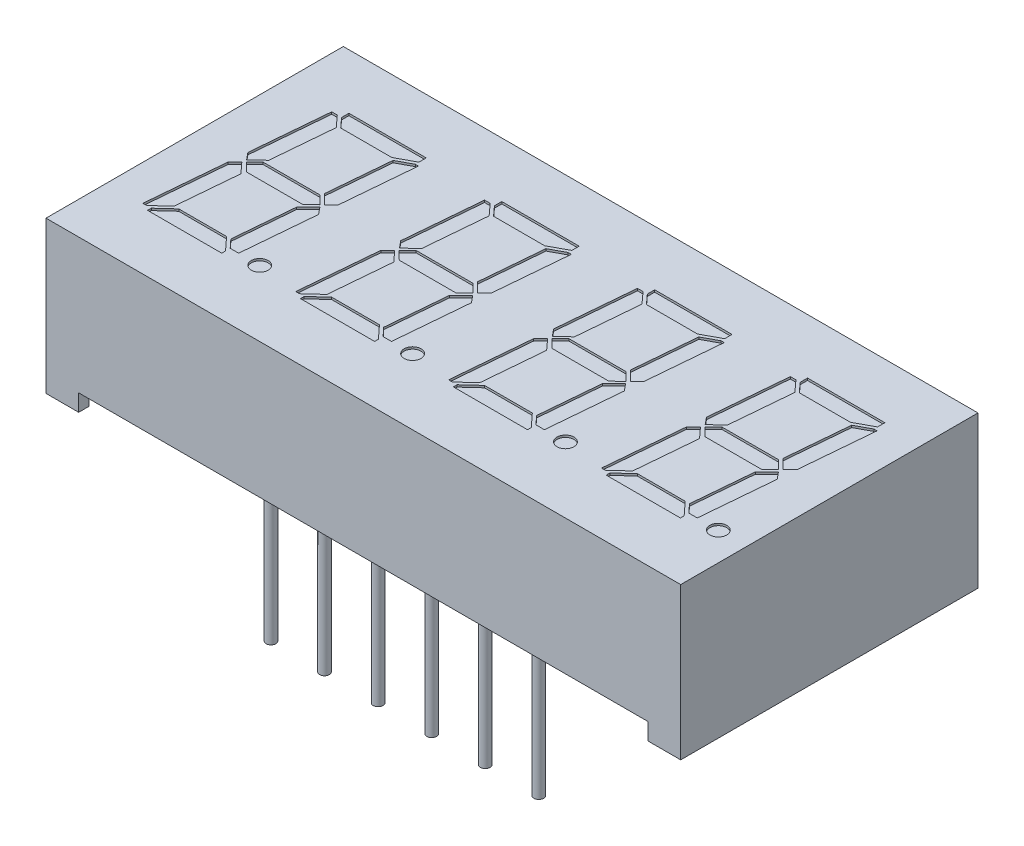
from build123d import *

# Parameters (mm, degrees)
SKETCH1_W                      = 30.1
SKETCH1_H                      = 14.1
BOSS_EXTRUDE1_DEPTH            = 7.2
SKETCH2_W                      = 27
SKETCH2_H                      = 0.8
CUT_EXTRUDE1_DEPTH             = 14.1
SKETCH3_W                      = 29.1
SKETCH3_H                      = 13.1
CUT_EXTRUDE2_DEPTH             = 0.5
CUT_EXTRUDE2_DIRECTION_2_REACH = 19.809
FILLET1_R                      = 1
FILLET2_R                      = 0.1
SKETCH4_R                      = 0.23
BOSS_EXTRUDE2_DEPTH            = 8.1
SKETCH5_R                      = 0.4
CUT_EXTRUDE3_DEPTH             = 0.1
LPATTERN1_COUNT                = 4
LPATTERN1_PITCH                = 7.25


with BuildPart() as part:
    # Sketch1 → Boss-Extrude1 (new body)
    with BuildSketch(Plane(origin=(0, 0, 0), x_dir=(1, 0, 0), z_dir=(0, 1, 0))):
        Rectangle(SKETCH1_W, SKETCH1_H)
    extrude(amount=-BOSS_EXTRUDE1_DEPTH)

    # Sketch2 → Cut-Extrude1 (cut)
    with BuildSketch(Plane.XY.offset(7.05)):
        with Locations((0, -6.8)):
            Rectangle(SKETCH2_W, SKETCH2_H)
    extrude(amount=-CUT_EXTRUDE1_DEPTH, mode=Mode.SUBTRACT)

    # Sketch3 → Cut-Extrude2 (cut)
    with BuildSketch(Plane.XZ.offset(6.4)):
        Rectangle(SKETCH3_W, SKETCH3_H)
    extrude(amount=-CUT_EXTRUDE2_DEPTH, mode=Mode.SUBTRACT)

    # Cut-Extrude2 direction 2: up to this face of the body (flat: up to its plane)
    cut_extrude2_direction_2_end = Plane(part.part.faces().sort_by_distance((-14.275, -7.2, 0))[0])
    # Sketch3 → Cut-Extrude2 direction 2 (cut, up to the picked face)
    with BuildSketch(Plane.XZ.offset(6.4), mode=Mode.PRIVATE) as cut_extrude2_direction_2_sk1:
        Rectangle(SKETCH3_W, SKETCH3_H)
    cut_extrude2_direction_2_tool1 = split(extrude(cut_extrude2_direction_2_sk1.sketch, amount=CUT_EXTRUDE2_DIRECTION_2_REACH, mode=Mode.PRIVATE), bisect_by=cut_extrude2_direction_2_end, keep=Keep.BOTH, mode=Mode.PRIVATE)
    add(cut_extrude2_direction_2_tool1.solids().sort_by(Axis((0, -6.4, 0), (0, -1, 0)))[0], mode=Mode.SUBTRACT)

    # Fillet1
    # the kernel refuses this fillet: 1 mm, written as the material it adds along each edge
    with BuildSketch(Plane(origin=(14.55, -5.9, 6.55), x_dir=(-1, 0, 0), z_dir=(0, 0, -1))) as fillet1_piece_1:
        with BuildLine():
            CenterArc((FILLET1_R, -FILLET1_R), FILLET1_R, 90, 90)
            Line((0, -FILLET1_R), (0, 0))
            Line((0, 0), (FILLET1_R, 0))
        make_face()
    extrude(amount=13.1)
    with BuildSketch(Plane(origin=(-14.55, -5.9, 6.55), x_dir=(0, -1, 0), z_dir=(1, 0, 0))) as fillet1_piece_2_section:
        with BuildLine():
            CenterArc((FILLET1_R, FILLET1_R), FILLET1_R, 180, 90)
            Line((0, FILLET1_R), (0, 0))
            Line((0, 0), (FILLET1_R, 0))
        make_face()
    fillet1_piece_2 = extrude(amount=29.1, mode=Mode.PRIVATE)
    fillet1_piece_2 = split(fillet1_piece_2, bisect_by=Plane(origin=(-13.5, -6.563250785, 6.525991618), z_dir=(-1, 0, 0)), keep=Keep.TOP, mode=Mode.PRIVATE)
    fillet1_piece_2 = split(fillet1_piece_2, bisect_by=Plane(origin=(-14.025, -6.4, 6.525991618), z_dir=(0, -1, 0)), keep=Keep.TOP, mode=Mode.PRIVATE)
    add(fillet1_piece_2)
    with BuildSketch(Plane(origin=(-14.55, -5.9, 6.55), x_dir=(0, -1, 0), z_dir=(1, 0, 0))) as fillet1_piece_3_section:
        with BuildLine():
            CenterArc((FILLET1_R, FILLET1_R), FILLET1_R, 180, 90)
            Line((0, FILLET1_R), (0, 0))
            Line((0, 0), (FILLET1_R, 0))
        make_face()
    fillet1_piece_3 = extrude(amount=29.1, mode=Mode.PRIVATE)
    fillet1_piece_3 = split(fillet1_piece_3, bisect_by=Plane(origin=(-13.5, -6.064391764, 6.29487994), z_dir=(-1, 0, 0)), keep=Keep.TOP, mode=Mode.PRIVATE)
    fillet1_piece_3 = split(fillet1_piece_3, bisect_by=Plane(origin=(-14.025, -6.4, 6.29487994), z_dir=(0, 1, 0)), keep=Keep.TOP, mode=Mode.PRIVATE)
    add(fillet1_piece_3)
    with BuildSketch(Plane(origin=(-14.55, -5.9, 6.55), x_dir=(0, -1, 0), z_dir=(1, 0, 0))) as fillet1_piece_4_section:
        with BuildLine():
            CenterArc((FILLET1_R, FILLET1_R), FILLET1_R, 180, 90)
            Line((0, FILLET1_R), (0, 0))
            Line((0, 0), (FILLET1_R, 0))
        make_face()
    fillet1_piece_4 = extrude(amount=29.1, mode=Mode.PRIVATE)
    fillet1_piece_4 = split(fillet1_piece_4, bisect_by=Plane(origin=(13.5, -6.064391764, 6.29487994), z_dir=(-1, 0, 0)), keep=Keep.TOP, mode=Mode.PRIVATE)
    fillet1_piece_4 = split(fillet1_piece_4, bisect_by=Plane(origin=(-13.5, -6.064391764, 6.29487994), z_dir=(1, 0, 0)), keep=Keep.TOP, mode=Mode.PRIVATE)
    fillet1_piece_4 = split(fillet1_piece_4, bisect_by=Plane(origin=(0, -6.4, 6.29487994), z_dir=(0, 1, 0)), keep=Keep.TOP, mode=Mode.PRIVATE)
    add(fillet1_piece_4)
    with BuildSketch(Plane(origin=(-14.55, -5.9, 6.55), x_dir=(0, -1, 0), z_dir=(1, 0, 0))) as fillet1_piece_5_section:
        with BuildLine():
            CenterArc((FILLET1_R, FILLET1_R), FILLET1_R, 180, 90)
            Line((0, FILLET1_R), (0, 0))
            Line((0, 0), (FILLET1_R, 0))
        make_face()
    fillet1_piece_5 = extrude(amount=29.1, mode=Mode.PRIVATE)
    fillet1_piece_5 = split(fillet1_piece_5, bisect_by=Plane(origin=(13.5, -6.563250785, 6.525991618), z_dir=(1, 0, 0)), keep=Keep.TOP, mode=Mode.PRIVATE)
    fillet1_piece_5 = split(fillet1_piece_5, bisect_by=Plane(origin=(14.025, -6.4, 6.525991618), z_dir=(0, -1, 0)), keep=Keep.TOP, mode=Mode.PRIVATE)
    add(fillet1_piece_5)
    with BuildSketch(Plane(origin=(-14.55, -5.9, 6.55), x_dir=(0, -1, 0), z_dir=(1, 0, 0))) as fillet1_piece_6_section:
        with BuildLine():
            CenterArc((FILLET1_R, FILLET1_R), FILLET1_R, 180, 90)
            Line((0, FILLET1_R), (0, 0))
            Line((0, 0), (FILLET1_R, 0))
        make_face()
    fillet1_piece_6 = extrude(amount=29.1, mode=Mode.PRIVATE)
    fillet1_piece_6 = split(fillet1_piece_6, bisect_by=Plane(origin=(13.5, -6.064391764, 6.29487994), z_dir=(1, 0, 0)), keep=Keep.TOP, mode=Mode.PRIVATE)
    fillet1_piece_6 = split(fillet1_piece_6, bisect_by=Plane(origin=(14.025, -6.4, 6.29487994), z_dir=(0, 1, 0)), keep=Keep.TOP, mode=Mode.PRIVATE)
    add(fillet1_piece_6)
    with BuildSketch(Plane(origin=(-14.55, -5.9, -6.55), x_dir=(0, -1, 0), z_dir=(0, 0, 1))) as fillet1_piece_7:
        with BuildLine():
            CenterArc((FILLET1_R, FILLET1_R), FILLET1_R, 180, 90)
            Line((0, FILLET1_R), (0, 0))
            Line((0, 0), (FILLET1_R, 0))
        make_face()
    extrude(amount=13.1)
    with BuildSketch(Plane(origin=(14.55, -5.9, -6.55), x_dir=(0, -1, 0), z_dir=(-1, 0, 0))) as fillet1_piece_8_section:
        with BuildLine():
            CenterArc((FILLET1_R, FILLET1_R), FILLET1_R, 180, 90)
            Line((0, FILLET1_R), (0, 0))
            Line((0, 0), (FILLET1_R, 0))
        make_face()
    fillet1_piece_8 = extrude(amount=29.1, mode=Mode.PRIVATE)
    fillet1_piece_8 = split(fillet1_piece_8, bisect_by=Plane(origin=(13.5, -6.563250785, -6.525991618), z_dir=(1, 0, 0)), keep=Keep.TOP, mode=Mode.PRIVATE)
    fillet1_piece_8 = split(fillet1_piece_8, bisect_by=Plane(origin=(14.025, -6.4, -6.525991618), z_dir=(0, -1, 0)), keep=Keep.TOP, mode=Mode.PRIVATE)
    add(fillet1_piece_8)
    with BuildSketch(Plane(origin=(14.55, -5.9, -6.55), x_dir=(0, -1, 0), z_dir=(-1, 0, 0))) as fillet1_piece_9_section:
        with BuildLine():
            CenterArc((FILLET1_R, FILLET1_R), FILLET1_R, 180, 90)
            Line((0, FILLET1_R), (0, 0))
            Line((0, 0), (FILLET1_R, 0))
        make_face()
    fillet1_piece_9 = extrude(amount=29.1, mode=Mode.PRIVATE)
    fillet1_piece_9 = split(fillet1_piece_9, bisect_by=Plane(origin=(13.5, -6.064391764, -6.29487994), z_dir=(1, 0, 0)), keep=Keep.TOP, mode=Mode.PRIVATE)
    fillet1_piece_9 = split(fillet1_piece_9, bisect_by=Plane(origin=(14.025, -6.4, -6.29487994), z_dir=(0, 1, 0)), keep=Keep.TOP, mode=Mode.PRIVATE)
    add(fillet1_piece_9)
    with BuildSketch(Plane(origin=(14.55, -5.9, -6.55), x_dir=(0, -1, 0), z_dir=(-1, 0, 0))) as fillet1_piece_10_section:
        with BuildLine():
            CenterArc((FILLET1_R, FILLET1_R), FILLET1_R, 180, 90)
            Line((0, FILLET1_R), (0, 0))
            Line((0, 0), (FILLET1_R, 0))
        make_face()
    fillet1_piece_10 = extrude(amount=29.1, mode=Mode.PRIVATE)
    fillet1_piece_10 = split(fillet1_piece_10, bisect_by=Plane(origin=(13.5, -6.064391764, -6.29487994), z_dir=(-1, 0, 0)), keep=Keep.TOP, mode=Mode.PRIVATE)
    fillet1_piece_10 = split(fillet1_piece_10, bisect_by=Plane(origin=(0, -6.4, -6.29487994), z_dir=(0, 1, 0)), keep=Keep.TOP, mode=Mode.PRIVATE)
    fillet1_piece_10 = split(fillet1_piece_10, bisect_by=Plane(origin=(-13.5, -6.064391764, -6.29487994), z_dir=(1, 0, 0)), keep=Keep.TOP, mode=Mode.PRIVATE)
    add(fillet1_piece_10)
    with BuildSketch(Plane(origin=(14.55, -5.9, -6.55), x_dir=(0, -1, 0), z_dir=(-1, 0, 0))) as fillet1_piece_11_section:
        with BuildLine():
            CenterArc((FILLET1_R, FILLET1_R), FILLET1_R, 180, 90)
            Line((0, FILLET1_R), (0, 0))
            Line((0, 0), (FILLET1_R, 0))
        make_face()
    fillet1_piece_11 = extrude(amount=29.1, mode=Mode.PRIVATE)
    fillet1_piece_11 = split(fillet1_piece_11, bisect_by=Plane(origin=(-14.025, -6.4, -6.525991618), z_dir=(0, -1, 0)), keep=Keep.TOP, mode=Mode.PRIVATE)
    fillet1_piece_11 = split(fillet1_piece_11, bisect_by=Plane(origin=(-13.5, -6.563250785, -6.525991618), z_dir=(-1, 0, 0)), keep=Keep.TOP, mode=Mode.PRIVATE)
    add(fillet1_piece_11)
    with BuildSketch(Plane(origin=(14.55, -5.9, -6.55), x_dir=(0, -1, 0), z_dir=(-1, 0, 0))) as fillet1_piece_12_section:
        with BuildLine():
            CenterArc((FILLET1_R, FILLET1_R), FILLET1_R, 180, 90)
            Line((0, FILLET1_R), (0, 0))
            Line((0, 0), (FILLET1_R, 0))
        make_face()
    fillet1_piece_12 = extrude(amount=29.1, mode=Mode.PRIVATE)
    fillet1_piece_12 = split(fillet1_piece_12, bisect_by=Plane(origin=(-14.025, -6.4, -6.29487994), z_dir=(0, 1, 0)), keep=Keep.TOP, mode=Mode.PRIVATE)
    fillet1_piece_12 = split(fillet1_piece_12, bisect_by=Plane(origin=(-13.5, -6.064391764, -6.29487994), z_dir=(-1, 0, 0)), keep=Keep.TOP, mode=Mode.PRIVATE)
    add(fillet1_piece_12)

    # Fillet2
    fillet2_edges = [part.edges().sort_by_distance(p)[0] for p in [
        (-14.55, -7.05, -6.55),
        (14.55, -7.05, 6.55),
        (-14.55, -7.05, 6.55),
        (14.55, -7.05, -6.55),
        (-14.02248141, -6.018659364, -6.02248141),
        (-14.196048907, -6.136703983, 6.196048907),
        (14.02248141, -6.018659364, -6.02248141),
        (14.02248141, -6.018659364, 6.02248141),
    ]]
    fillet(fillet2_edges, radius=FILLET2_R)

    # Sketch4 → Boss-Extrude2 (add)
    with BuildSketch(Plane.XZ.offset(5.9)):
        with Locations(Location((1.27, 5.08, 0), (0, 0, 90))):
            Circle(SKETCH4_R)
        with Locations(Location((3.81, 5.08, 0), (0, 0, 90))):
            Circle(SKETCH4_R)
        with Locations(Location((6.35, 5.08, 0), (0, 0, 90))):
            Circle(SKETCH4_R)
        with Locations(Location((-1.27, 5.08, 0), (0, 0, 90))):
            Circle(SKETCH4_R)
        with Locations(Location((-3.81, 5.08, 0), (0, 0, 90))):
            Circle(SKETCH4_R)
        with Locations(Location((-6.35, 5.08, 0), (0, 0, 90))):
            Circle(SKETCH4_R)
        with Locations(Location((1.27, -5.08, 0), (0, 0, 90))):
            Circle(SKETCH4_R)
        with Locations(Location((-1.27, -5.08, 0), (0, 0, 90))):
            Circle(SKETCH4_R)
        with Locations(Location((3.81, -5.08, 0), (0, 0, 90))):
            Circle(SKETCH4_R)
        with Locations(Location((6.35, -5.08, 0), (0, 0, 90))):
            Circle(SKETCH4_R)
        with Locations(Location((-3.81, -5.08, 0), (0, 0, 90))):
            Circle(SKETCH4_R)
        with Locations(Location((-6.35, -5.08, 0), (0, 0, 90))):
            Circle(SKETCH4_R)
    extrude(amount=BOSS_EXTRUDE2_DEPTH)

    # Sketch5 → Cut-Extrude3 (cut)
    with BuildSketch(Plane(origin=(0, 0, 0), x_dir=(1, 0, 0), z_dir=(0, 1, 0))):
        with Locations(Location((13.706927907, -3.921331965, 0), (0, 0, 270))):
            Circle(SKETCH5_R)
        Polygon((13.011973007, -0.434650521), (12.706927907, -3.921331965), (12.306927907, -3.921331965), (11.938867503, -3.521331965), (12.190090223, -0.649843134), (12.74097703, -0.103133014), align=None)
        Polygon((13.088026993, 0.434650521), (13.393072093, 3.921331965), (13.243072093, 3.921331965), (12.557622938, 3.551075023), (12.29615571, 0.562490929), (12.75902297, 0.103133014), align=None)
        Polygon((12.24694413, 0.4), (9.55305587, 0.4), (9.15, 0), (9.55305587, -0.4), (12.24694413, -0.4), (12.65, 0), align=None)
        Polygon((8.788026993, 0.434650521), (9.05902297, 0.103133014), (9.606088613, 0.606167031), (9.863734678, 3.551075023), (9.372666371, 4.091816733), (9.107987577, 4.091816733), align=None)
        Polygon((8.711973007, -0.434650521), (9.04097703, -0.103133014), (9.500023127, -0.606167031), (9.244979243, -3.521331965), (8.566019219, -4.142859505), (8.387546759, -4.142859505), align=None)
        Polygon((13.243072093, 4.091816733), (12.40764311, 3.640545653), (9.985106001, 3.640545653), (9.575289408, 4.091816733), (9.575289408, 4.440545653), (13.243072093, 4.440545653), align=None)
        Polygon((11.735028712, -3.521331965), (12.306927907, -4.142859505), (12.306927907, -4.321331965), (8.788168636, -4.321331965), (8.788168636, -4.142859505), (9.46712866, -3.521331965), align=None)
    cut_extrude3 = extrude(amount=-CUT_EXTRUDE3_DEPTH, mode=Mode.SUBTRACT)

    # LPattern1: Cut-Extrude3 ×4
    with Locations(*[(-i * LPATTERN1_PITCH, 0, 0) for i in range(1, LPATTERN1_COUNT)]):
        add(cut_extrude3, mode=Mode.SUBTRACT)


solid = part.part
